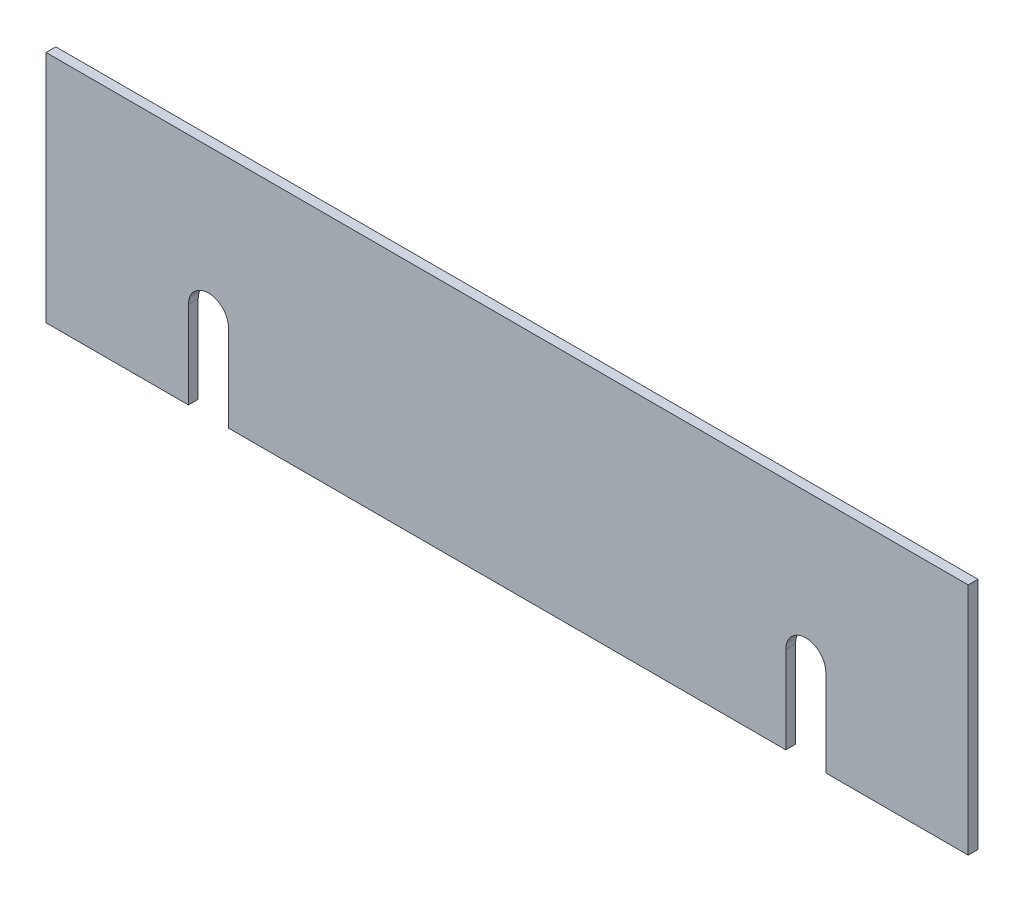
from build123d import *

# Parameters (mm, degrees)
SKETCH1_W           = 299.7
SKETCH1_H           = 76.075
BOSS_EXTRUDE1_DEPTH = 3.175
CUT_EXTRUDE1_DEPTH  = 155.634907221


with BuildPart() as part:
    # Sketch1 → Boss-Extrude1 (new body)
    with BuildSketch(Plane.XY):
        Rectangle(SKETCH1_W, SKETCH1_H)
    extrude(amount=BOSS_EXTRUDE1_DEPTH)

    # Sketch3 → Cut-Extrude1 (cut, through all)
    with BuildSketch(Plane(origin=(0, 0, 0), x_dir=(-1, 0, 0), z_dir=(0, 0, -1))):
        with BuildLine():
            Line((-103.563134869, -38.0375), (-90.563134869, -38.0375))
            Line((-90.563134869, -38.0375), (-90.563134869, -9.7625))
            ThreePointArc((-90.563134869, -9.7625), (-97.063134869, -3.2625), (-103.563134869, -9.7625))
            Line((-103.563134869, -9.7625), (-103.563134869, -38.0375))
        make_face()
        with BuildLine():
            ThreePointArc((103.563134869, -9.7625), (97.063134869, -3.2625), (90.563134869, -9.7625))
            Line((90.563134869, -9.7625), (90.563134869, -38.0375))
            Line((90.563134869, -38.0375), (103.563134869, -38.0375))
            Line((103.563134869, -38.0375), (103.563134869, -9.7625))
        make_face()
    extrude(amount=-CUT_EXTRUDE1_DEPTH, mode=Mode.SUBTRACT)


solid = part.part
